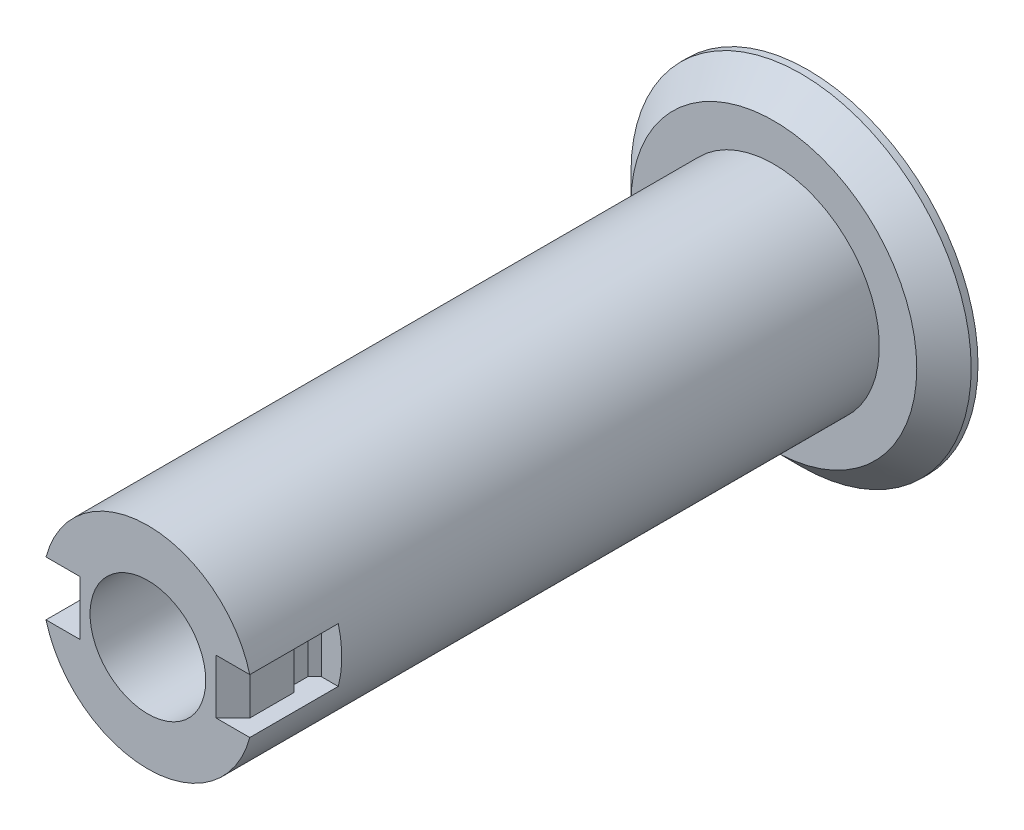
from build123d import *

# Parameters (mm, degrees)
AXLE_BASE_SKETCH_R          = 15.5
AXLE_DEPTH                  = 92
GUARD_BASE_R                = 25
GUARD_DEPTH                 = 5
INNER_AXLE_HOLE_BASE_R      = 8.5
INNER_AXLE_HOLE_DEPTH       = 104.242433137
COUPLING_TOOTH_HOLE_DEPTH   = 4
UNCOUPLING_FINGER_ROOM_SIZE = 4


with BuildPart() as part:
    # Axle base sketch → Axle (new body)
    with BuildSketch(Plane.XY):
        Circle(AXLE_BASE_SKETCH_R)
    extrude(amount=AXLE_DEPTH)

    # Guard base → Guard (add)
    with BuildSketch(Plane(origin=(0, 0, 0), x_dir=(-1, 0, 0), z_dir=(0, 0, -1))):
        Circle(GUARD_BASE_R)
    extrude(amount=GUARD_DEPTH)

    # Inner axle hole base → Inner axle hole (cut, through all)
    with BuildSketch(Plane.XY.offset(92)):
        Circle(INNER_AXLE_HOLE_BASE_R)
    extrude(amount=-INNER_AXLE_HOLE_DEPTH, mode=Mode.SUBTRACT)

    # Coupling tooth base → Coupling tooth hole (cut, symmetric)
    with BuildSketch(Plane(origin=(0, 0, 0), x_dir=(1, 0, 0), z_dir=(0, 1, 0))):
        Polygon((12.5, -89.5), (10, -92), (15.5, -92), (15.5, -79), (12.5, -79), (11.5, -80), (11.5, -82), (12.5, -83), align=None)
    coupling_tooth_hole = extrude(amount=COUPLING_TOOTH_HOLE_DEPTH, both=True, mode=Mode.SUBTRACT)

    # Coupling teeth: Coupling tooth hole across plane
    add(coupling_tooth_hole.mirror(Plane(origin=(0, 0, 0), x_dir=(0, 0, 1), z_dir=(1, 0, 0))), mode=Mode.SUBTRACT)

    # Uncoupling finger room
    uncoupling_finger_room_edges = [part.edges().sort_by_distance(p)[0] for p in [
        (25, 0, 0),
    ]]
    chamfer(uncoupling_finger_room_edges, length=UNCOUPLING_FINGER_ROOM_SIZE)


solid = part.part
